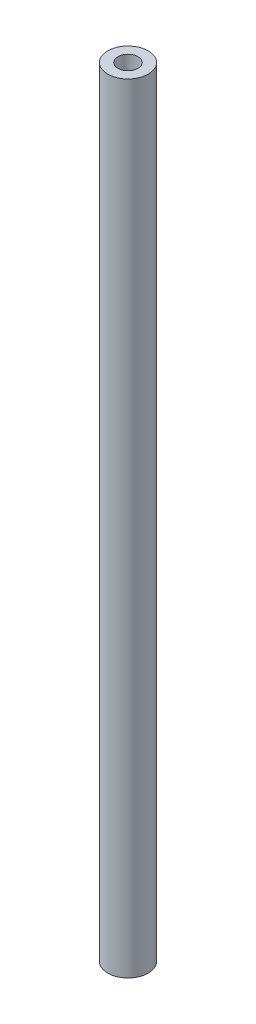
from build123d import *

# Parameters (mm, degrees)
SKETCH1_R           = 9.525
SKETCH1_R_2         = 4.7625
BOSS_EXTRUDE1_DEPTH = 367.03


with BuildPart() as part:
    # Sketch1 → Boss-Extrude1 (new body)
    with BuildSketch(Plane(origin=(0, 0, 0), x_dir=(1, 0, 0), z_dir=(0, 1, 0))):
        Circle(SKETCH1_R)
        Circle(SKETCH1_R_2, mode=Mode.SUBTRACT)
    extrude(amount=BOSS_EXTRUDE1_DEPTH)


solid = part.part
